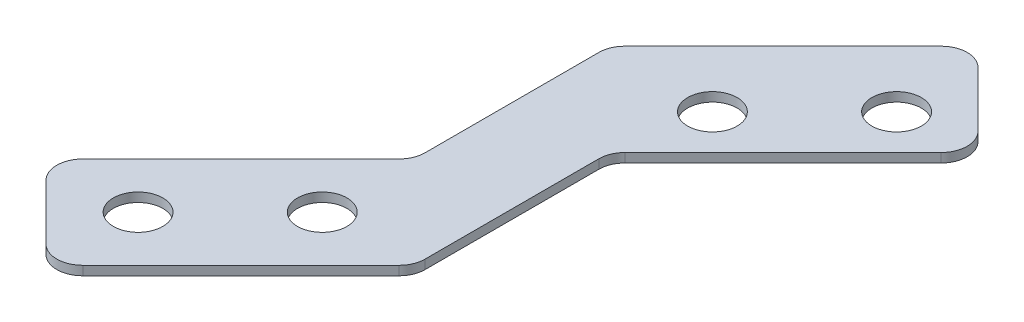
from build123d import *

# Parameters (mm, degrees)
BASE_FLANGE2_DEPTH    = 0.7
F_6_CLEARANCE_HOLE1_D = 3.7973
FILLET1_R             = 2


# Sheet-metal steps are written as plain solids
with BuildPart() as part:
    # Sketch1 → Base-Flange2 (new body)
    with BuildSketch(Plane(origin=(0, 0, 0), x_dir=(1, 0, 0), z_dir=(0, 1, 0))):
        Polygon((0, 0), (0, 15), (14.142135624, 29.142135624), (7.071067812, 36.213203436), (-7.071067812, 22.071067812), (-7.071067812, 7.071067812), (-21.213203436, -7.071067812), (-14.142135624, -14.142135624), align=None)
    extrude(amount=-BASE_FLANGE2_DEPTH)

    # #6 Clearance Hole1 (through all)
    with Locations(Plane(origin=(0, 0, 0), x_dir=(1, 0, 0), z_dir=(0, 1, 0))):
        with Locations((-14.139821541, -7.073381895), (-7.068753729, -0.002314083), (1.237436867, 21.653874811), (8.308504679, 28.724942623)):
            Hole(F_6_CLEARANCE_HOLE1_D / 2)

    # Fillet1
    fillet1_edges = [part.edges().sort_by_distance(p)[0] for p in [
        (-14.142135624, -0.35, 14.142135624),
        (-21.213203436, -0.35, 7.071067812),
        (-7.071067812, -0.35, -7.071067812),
        (-7.071067812, -0.35, -22.071067812),
        (7.071067812, -0.35, -36.213203436),
        (14.142135624, -0.35, -29.142135624),
        (0, -0.35, -15),
        (0, -0.35, 0),
    ]]
    fillet(fillet1_edges, radius=FILLET1_R)


solid = part.part
